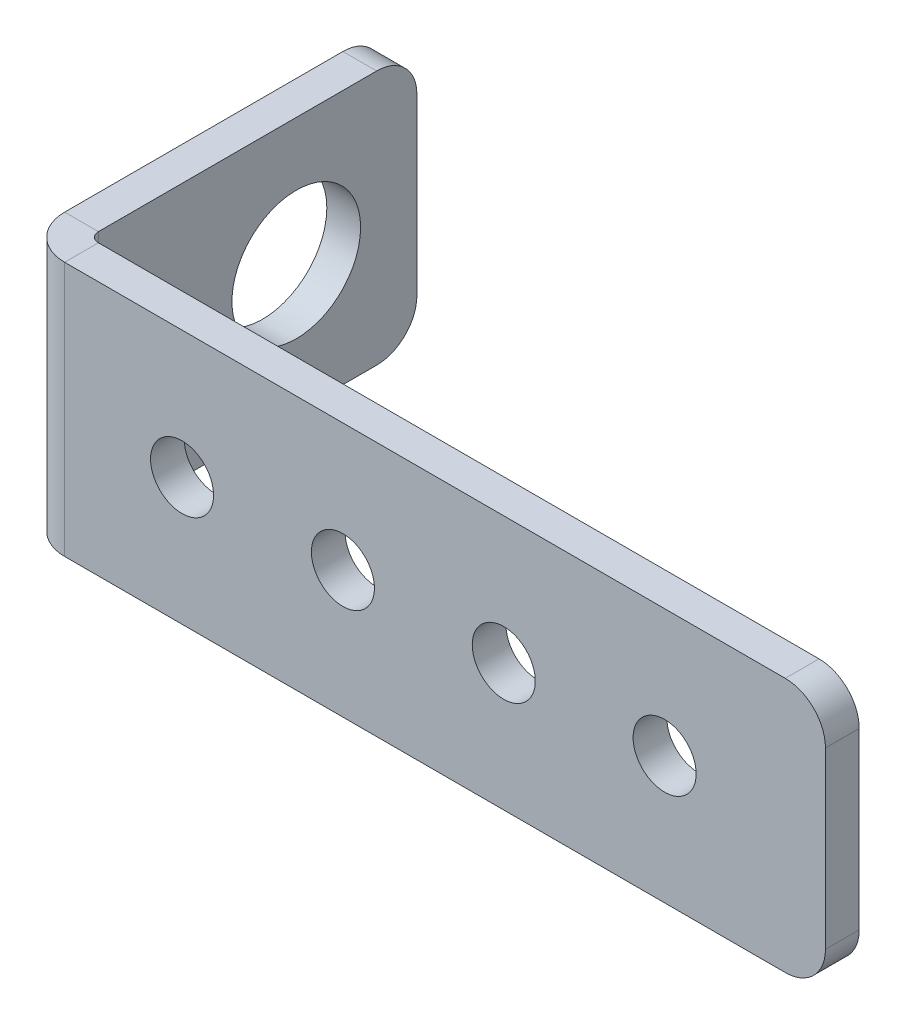
from build123d import *

# Parameters (mm, degrees)
BASE_FLANGE1_DEPTH = 20.1168
SKETCH6_R          = 2.4892
CUT_EXTRUDE1_DEPTH = 72.471393622
SKETCH7_R          = 5.08
CUT_EXTRUDE2_DEPTH = 71.156041481
FILLET1_R          = 3.175


# Read off the part's stored shape, not the designer's step: Base-Flange1
with BuildPart() as part:
    # Base-Flange1 outline → Base-Flange1 (new body)
    with BuildSketch(Plane(origin=(0, 0, 0), x_dir=(1, 0, 0), z_dir=(0, 1, 0))):
        with BuildLine():
            Line((3.429, 0), (63.5, 0))
            Line((63.5, 0), (63.5, 2.667))
            Line((63.5, 2.667), (3.429, 2.667))
            ThreePointArc((3.429, 2.667), (2.890184633, 2.890184633), (2.667, 3.429))
            Line((2.667, 3.429), (2.667, 28.575))
            Line((2.667, 28.575), (0, 28.575))
            Line((0, 28.575), (0, 3.429))
            ThreePointArc((0, 3.429), (1.004330847, 1.004330847), (3.429, 0))
        make_face()
    extrude(amount=BASE_FLANGE1_DEPTH)

    # Sketch6 → Cut-Extrude1 (cut, through all)
    with BuildSketch(Plane(origin=(0, 0, -2.667), x_dir=(-1, 0, 0), z_dir=(0, 0, -1))):
        with Locations((-50.8, 10.0584)):
            Circle(SKETCH6_R)
        with Locations((-38.1, 10.0584)):
            Circle(SKETCH6_R)
        with Locations((-25.4, 10.0584)):
            Circle(SKETCH6_R)
        with Locations((-12.7, 10.0584)):
            Circle(SKETCH6_R)
    extrude(amount=-CUT_EXTRUDE1_DEPTH, mode=Mode.SUBTRACT)

    # Sketch7 → Cut-Extrude2 (cut, through all)
    with BuildSketch(Plane(origin=(2.667, 0, 0), x_dir=(0, 0, -1), z_dir=(1, 0, 0))):
        with Locations((19.05, 10.0584)):
            Circle(SKETCH7_R)
    extrude(amount=-CUT_EXTRUDE2_DEPTH, mode=Mode.SUBTRACT)

    # Fillet1
    fillet1_edges = [part.edges().sort_by_distance(p)[0] for p in [
        (1.3335, 20.1168, -28.575),
        (1.3335, 0, -28.575),
        (63.5, 20.1168, -1.3335),
        (63.5, 0, -1.3335),
    ]]
    fillet(fillet1_edges, radius=FILLET1_R)


solid = part.part
